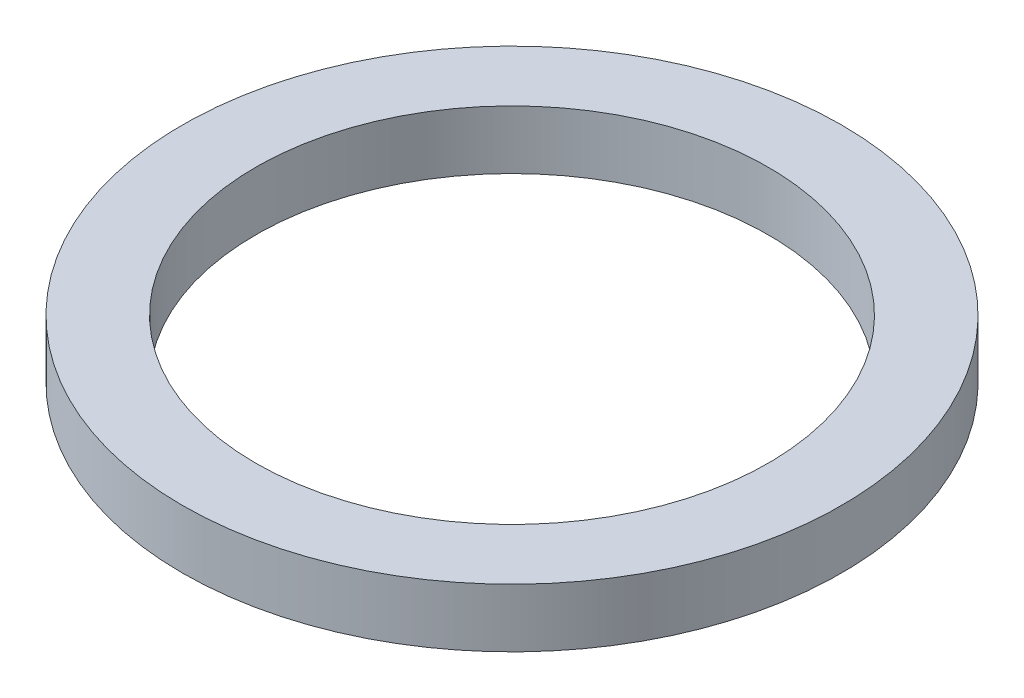
from build123d import *

# Parameters (mm, degrees)
SKETCH1_R           = 45
BOSS_EXTRUDE1_DEPTH = 8
SKETCH2_R           = 35
CUT_EXTRUDE1_DEPTH  = 65.140470843


with BuildPart() as part:
    # Sketch1 → Boss-Extrude1 (new body)
    with BuildSketch(Plane(origin=(0, 0, 0), x_dir=(1, 0, 0), z_dir=(0, 1, 0))):
        Circle(SKETCH1_R)
    extrude(amount=BOSS_EXTRUDE1_DEPTH)

    # Sketch2 → Cut-Extrude1 (cut, through all)
    with BuildSketch(Plane(origin=(0, 0, 0), x_dir=(1, 0, 0), z_dir=(0, 1, 0))):
        Circle(SKETCH2_R)
    extrude(amount=CUT_EXTRUDE1_DEPTH, mode=Mode.SUBTRACT)


solid = part.part
